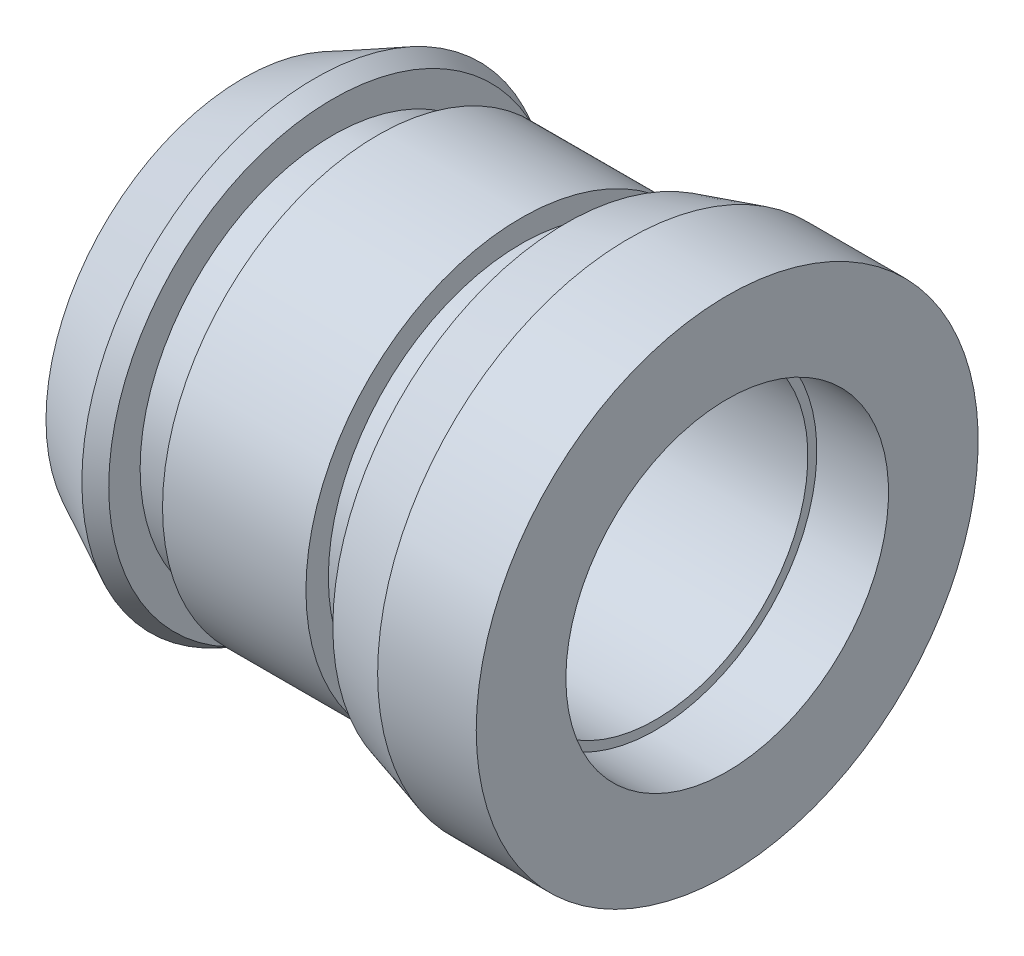
from build123d import *


with BuildPart() as part:
    # Sketch1 → Revolve1 (revolve)
    with BuildSketch(Plane(origin=(0, 0, 0), x_dir=(1, 0, 0), z_dir=(0, 1, 0))):
        Polygon((-49.2125, 28.575), (-49.2125, 34.925), (-36.5125, 41.275), (-33.3375, 39.6875), (-33.3375, 34.13125), (-25.4, 34.13125), (-25.4, 38.1), (0, 38.1), (0, 34.13125), (7.9375, 34.13125), (7.9375, 41.275), (19.05, 44.45), (36.5125, 44.45), (36.5125, 28.575), (23.8125, 28.575), (23.8125, 26.9875), (-23.8125, 26.9875), (-23.8125, 28.575), align=None)
    revolve(axis=Axis((-96.818823529, 0, 0), (1, 0, 0)))


solid = part.part
